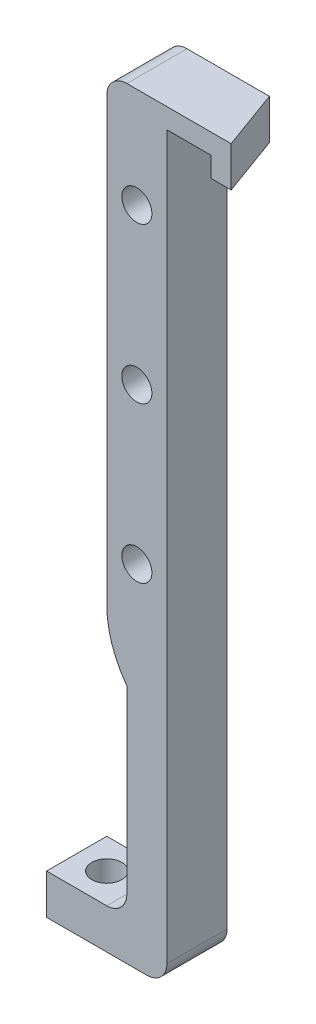
from build123d import *

# Parameters (mm, degrees)
SKETCH1_W             = 7.62
SKETCH1_H             = 96.52
BOSS_EXTRUDE1_DEPTH   = 7.62
SKETCH2_W             = 7.62
SKETCH2_H             = 5.08
BOSS_EXTRUDE2_DEPTH   = 7.62
SKETCH4_W             = 7.62
SKETCH4_H             = 2.54
BOSS_EXTRUDE3_DEPTH   = 8.128
BOSS_EXTRUDE4_DEPTH   = 2.54
F_6_CLEARANCE_HOLE1_D = 3.7973
CUT_EXTRUDE1_DEPTH    = 2.54
SKETCH12_W            = 7.62
SKETCH12_H            = 25.4
CUT_EXTRUDE2_DEPTH    = 2.54
FILLET2_R             = 12.7
FILLET3_R             = 2.54
SKETCH14_R            = 1.905
CUT_EXTRUDE4_DEPTH    = 99.092682214


with BuildPart() as part:
    # Sketch1 → Boss-Extrude1 (new body)
    with BuildSketch(Plane(origin=(0, 0, 0), x_dir=(0, 0, -1), z_dir=(1, 0, 0))):
        with Locations((3.81, 48.26)):
            Rectangle(SKETCH1_W, SKETCH1_H)
    extrude(amount=BOSS_EXTRUDE1_DEPTH)

    # Sketch2 → Boss-Extrude2 (add)
    with BuildSketch(Plane.ZY):
        with Locations((-3.81, 2.54)):
            Rectangle(SKETCH2_W, SKETCH2_H)
    extrude(amount=BOSS_EXTRUDE2_DEPTH)

    # Sketch4 → Boss-Extrude3 (add)
    with BuildSketch(Plane(origin=(7.62, 0, 0), x_dir=(0, 0, -1), z_dir=(1, 0, 0))):
        with Locations((3.81, 95.25)):
            Rectangle(SKETCH4_W, SKETCH4_H)
    extrude(amount=BOSS_EXTRUDE3_DEPTH)

    # Sketch5 → Boss-Extrude4 (add)
    with BuildSketch(Plane.XZ.offset(-93.98)):
        Polygon((15.748, 0), (12.974546815, -7.62), (10.434546815, -7.62), (13.208, 0), align=None)
    extrude(amount=BOSS_EXTRUDE4_DEPTH)

    # #6 Clearance Hole1 (through all)
    with Locations(Plane(origin=(0, 5.08, 0), x_dir=(1, 0, 0), z_dir=(0, 1, 0))):
        with Locations((-3.81, 3.81)):
            Hole(F_6_CLEARANCE_HOLE1_D / 2)

    # Sketch8 → Cut-Extrude1 (cut)
    with BuildSketch(Plane.XZ.offset(-93.98)):
        Polygon((15.748, -7.62), (12.974546815, -7.62), (15.748, 0), align=None)
    extrude(amount=-CUT_EXTRUDE1_DEPTH, mode=Mode.SUBTRACT)

    # Sketch12 → Cut-Extrude2 (cut)
    with BuildSketch(Plane.ZY):
        with Locations((-3.81, 17.78)):
            Rectangle(SKETCH12_W, SKETCH12_H)
    extrude(amount=-CUT_EXTRUDE2_DEPTH, mode=Mode.SUBTRACT)

    # Fillet2
    # the kernel refuses this fillet: 12.7 mm, written as the material it takes off along each edge
    with BuildSketch(Plane(origin=(0, 30.48, 19.05), x_dir=(1, 0, 0), z_dir=(0, 0, -1))) as fillet2_piece_1:
        with BuildLine():
            CenterArc((12.7, -7.62), FILLET2_R, 143.130102354, 36.869897646)
            Line((0, -7.62), (-0.254, -7.62))
            Line((-0.254, -7.62), (-0.254, 0))
            Line((-0.254, 0), (0, 0.254))
            ThreePointArc((0, 0.254), (1.27, 0.254), (2.3368, 0.1524))
            Line((2.3368, 0.1524), (2.54, 0))
        make_face()
    extrude(amount=45.72, mode=Mode.SUBTRACT)

    # Fillet3
    fillet3_edges = [part.edges().sort_by_distance(p)[0] for p in [
        (2.54, 5.08, -3.81),
        (7.62, 0, -3.81),
        (0, 96.52, -3.81),
    ]]
    fillet(fillet3_edges, radius=FILLET3_R)

    # Sketch14 → Cut-Extrude4 (cut, through all)
    with BuildSketch(Plane.XY):
        with Locations((3.81, 83.82)):
            Circle(SKETCH14_R)
        with Locations((3.81, 44.45)):
            Circle(SKETCH14_R)
        with Locations((3.81, 64.135)):
            Circle(SKETCH14_R)
    extrude(amount=-CUT_EXTRUDE4_DEPTH, mode=Mode.SUBTRACT)


solid = part.part
